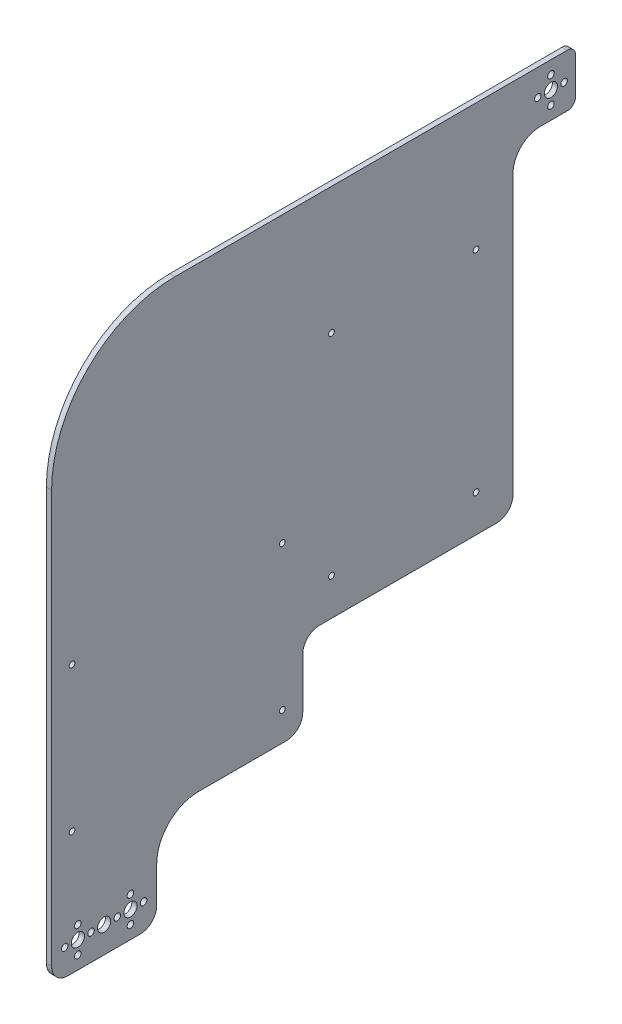
from build123d import *

# Parameters (mm, degrees)
SKETCH1_R           = 4
SKETCH1_R_2         = 2
SKETCH1_R_3         = 1.75
BOSS_EXTRUDE1_DEPTH = 3.175


with BuildPart() as part:
    # Sketch1 → Boss-Extrude1 (new body)
    with BuildSketch(Plane(origin=(0, 0, 0), x_dir=(0, 0, -1), z_dir=(1, 0, 0))):
        with BuildLine():
            Line((-240, -288), (-240, -310))
            ThreePointArc((-240, -310), (-242.928932188, -317.071067812), (-250, -320))
            Line((-250, -320), (-294, -320))
            ThreePointArc((-294, -320), (-301.071067812, -317.071067812), (-304, -310))
            Line((-304, -310), (-304, -288))
            Line((-304, -288), (-304, -59))
            ThreePointArc((-304, -59), (-282.033008589, -5.966991411), (-229, 16))
            Line((-229, 16), (-16, 16))
            Line((-16, 16), (10, 16))
            ThreePointArc((10, 16), (13.535533906, 14.535533906), (15, 11))
            Line((15, 11), (15, -11))
            ThreePointArc((15, -11), (13.535533906, -14.535533906), (10, -16))
            Line((10, -16), (-6.55, -16))
            ThreePointArc((-6.55, -16), (-18.252617229, -20.847382771), (-23.1, -32.55))
            Line((-23.1, -32.55), (-23.1, -201.8))
            ThreePointArc((-23.1, -201.8), (-26.028932188, -208.871067812), (-33.1, -211.8))
            Line((-33.1, -211.8), (-141.1, -211.8))
            ThreePointArc((-141.1, -211.8), (-148.171067812, -214.728932188), (-151.1, -221.8))
            Line((-151.1, -221.8), (-151.1, -252.6))
            ThreePointArc((-151.1, -252.6), (-154.028932188, -259.671067812), (-161.1, -262.6))
            Line((-161.1, -262.6), (-214.6, -262.6))
            ThreePointArc((-214.6, -262.6), (-232.560512242, -270.039487758), (-240, -288))
        make_face()
        with Locations((-256, -304)):
            Circle(SKETCH1_R, mode=Mode.SUBTRACT)
        Circle(SKETCH1_R, mode=Mode.SUBTRACT)
        with Locations((8, 0)):
            Circle(SKETCH1_R_2, mode=Mode.SUBTRACT)
        with Locations((0, -8)):
            Circle(SKETCH1_R_2, mode=Mode.SUBTRACT)
        with Locations((-8, 0)):
            Circle(SKETCH1_R_2, mode=Mode.SUBTRACT)
        with Locations((0, 8)):
            Circle(SKETCH1_R_2, mode=Mode.SUBTRACT)
        with Locations((-248, -304)):
            Circle(SKETCH1_R_2, mode=Mode.SUBTRACT)
        with Locations((-256, -312)):
            Circle(SKETCH1_R_2, mode=Mode.SUBTRACT)
        with Locations((-256, -296)):
            Circle(SKETCH1_R_2, mode=Mode.SUBTRACT)
        with Locations((-264, -304)):
            Circle(SKETCH1_R_2, mode=Mode.SUBTRACT)
        with Locations((-272, -304)):
            Circle(SKETCH1_R, mode=Mode.SUBTRACT)
        with Locations((-288, -312)):
            Circle(SKETCH1_R_2, mode=Mode.SUBTRACT)
        with Locations((-280, -304)):
            Circle(SKETCH1_R_2, mode=Mode.SUBTRACT)
        with Locations((-288, -296)):
            Circle(SKETCH1_R_2, mode=Mode.SUBTRACT)
        with Locations((-288, -304)):
            Circle(SKETCH1_R, mode=Mode.SUBTRACT)
        with Locations((-296, -304)):
            Circle(SKETCH1_R_2, mode=Mode.SUBTRACT)
        with Locations((-133.6, -61.3)):
            Circle(SKETCH1_R_3, mode=Mode.SUBTRACT)
        with Locations((-45.6, -61.3)):
            Circle(SKETCH1_R_3, mode=Mode.SUBTRACT)
        with Locations((-45.6, -189.3)):
            Circle(SKETCH1_R_3, mode=Mode.SUBTRACT)
        with Locations((-133.6, -189.3)):
            Circle(SKETCH1_R_3, mode=Mode.SUBTRACT)
        with Locations((-291.55, -245.1)):
            Circle(SKETCH1_R_3, mode=Mode.SUBTRACT)
        with Locations((-291.55, -157.1)):
            Circle(SKETCH1_R_3, mode=Mode.SUBTRACT)
        with Locations((-163.55, -157.1)):
            Circle(SKETCH1_R_3, mode=Mode.SUBTRACT)
        with Locations((-163.55, -245.1)):
            Circle(SKETCH1_R_3, mode=Mode.SUBTRACT)
    extrude(amount=-BOSS_EXTRUDE1_DEPTH)


solid = part.part
